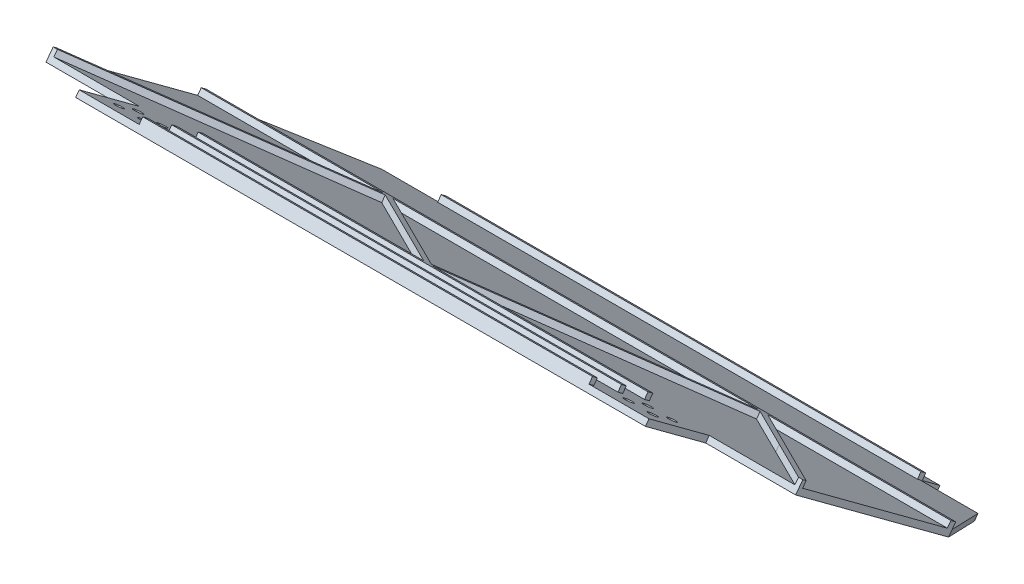
from build123d import *

# Parameters (mm, degrees)
SHELL_2_T            = -3
SKETCH_4_R           = 1.5
CUT_EXTRUDE_1_DEPTH  = 10
EXTRUDE_1_DEPTH      = 40.5
SKETCH_7_R           = 1.51
CUT_EXTRUDE_2_DEPTH  = 100
SKETCH_8_R           = 1.5
EXTRUDE_2_DEPTH      = 3
EXTRUDE_3_DEPTH      = 4
SKETCH_11_W          = 56.2
SKETCH_11_H          = 25
CUT_EXTRUDE_3_DEPTH  = 4
SKETCH_12_W          = 3
SKETCH_12_H          = 215
EXTRUDE_5_DEPTH      = 10
SKETCH_13_W          = 10
SKETCH_13_H          = 215
CUT_EXTRUDE_4_DEPTH  = 300
SKETCH_15_W          = 116.702064096
SKETCH_15_H          = 65.174269722
SKETCH_15_W_2        = 111.85
SKETCH_15_H_2        = 80
CUT_EXTRUDE_5_DEPTH  = 4
EXTRUDE_6_DEPTH      = 4
SKETCH_17_W          = 56.2
SKETCH_17_H          = 25
CUT_EXTRUDE_6_DEPTH  = 4
EXTRUDE_7_DEPTH      = 4
SKETCH_20_R          = 1.5
CUT_EXTRUDE_7_DEPTH  = 10
SKETCH_21_W          = 185
SKETCH_21_H          = 185
CUT_EXTRUDE_8_DEPTH  = 37.5
EXTRUDE_START        = 1
SKETCH_22_W          = 185
SKETCH_22_H          = 185
SKETCH_22_R          = 1.5
EXTRUDE_8_DEPTH      = 1
CUT_EXTRUDE_START    = -2
SKETCH_24_R          = 3
SKETCH_24_R_2        = 1.5
CUT_EXTRUDE_9_DEPTH  = 2
SKETCH_25_R          = 1.51
CUT_EXTRUDE_10_DEPTH = 10
SKETCH_26_R          = 1.5
EXTRUDE_9_DEPTH      = 4
EXTRUDE_START_2      = -4
SKETCH_28_R          = 3
EXTRUDE_10_DEPTH     = 4
SKETCH_29_R          = 3
CUT_EXTRUDE_11_DEPTH = 2
SKETCH_30_W          = 20
SKETCH_30_H          = 20
EXTRUDE_11_DEPTH     = 300
EXTRUDE_11_2_DEPTH   = 300
EXTRUDE_11_3_DEPTH   = 300
EXTRUDE_11_4_DEPTH   = 300
SKETCH_31_W          = 20
SKETCH_31_H          = 20
EXTRUDE_12_DEPTH     = 300
EXTRUDE_13_DEPTH     = 2
EXTRUDE_14_DEPTH     = 2
SKETCH_34_W          = 360
SKETCH_34_H          = 2
EXTRUDE_15_DEPTH     = 40
CUT_EXTRUDE_12_DEPTH = 400
SKETCH_36_W          = 360
SKETCH_36_H          = 35.328815684
CUT_EXTRUDE_13_DEPTH = 1
SKETCH_38_W          = 80
SKETCH_38_H          = 33.975155378
CUT_EXTRUDE_16_DEPTH = 3
SKETCH_40_R          = 1.5
CUT_EXTRUDE_17_DEPTH = 3
CUT_EXTRUDE_18_DEPTH = 3
SKETCH_42_W          = 20
SKETCH_42_H          = 20
SKETCH_42_W_2        = 200
SKETCH_42_H_2        = 194.4594667
CUT_EXTRUDE_19_DEPTH = 1000
SKETCH_43_W          = 200
SKETCH_43_H          = 10.011542291
CUT_EXTRUDE_20_DEPTH = 1000
SKETCH_44_W          = 5
SKETCH_44_H          = 25
CUT_EXTRUDE_21_DEPTH = 5
SKETCH_46_W          = 190
SKETCH_46_H          = 2
EXTRUDE_16_DEPTH     = 2
SKETCH_47_W          = 20
SKETCH_47_H          = 25
CUT_EXTRUDE_22_DEPTH = 2
SKETCH_48_W          = 250
SKETCH_48_H          = 2
EXTRUDE_17_DEPTH     = 2
EXTRUDE_18_DEPTH     = 2
CUT_EXTRUDE_24_DEPTH = 2
CUT_EXTRUDE_25_DEPTH = 2


with BuildPart() as part:
    # 草图3 → 放样1 section 0
    with BuildSketch(Plane.XY.offset(20)):
        with BuildLine():
            Line((-32.460246779, 32.274755465), (182.539753221, 32.274755465))
            Line((182.539753221, 32.274755465), (182.539753221, -182.725244535))
            Line((182.539753221, -182.725244535), (-32.460246779, -182.725244535))
            Line((-32.460246779, -182.725244535), (-32.460246779, 32.274755465))
        make_face()
    # 草图1 → 放样1 section 1
    with BuildSketch(Plane.XY):
        with BuildLine():
            Line((-17.5, -167.5), (167.5, -167.5))
            Line((167.5, -167.5), (167.5, 17.5))
            Line((167.5, 17.5), (-17.5, 17.5))
            Line((-17.5, 17.5), (-17.5, -167.5))
        make_face()
    loft()

    # 抽壳2
    shell_2_openings = [part.faces().sort_by_distance(p)[0] for p in [
        (75.039753221, -75.225244535, 20),
    ]]
    offset(amount=SHELL_2_T, openings=shell_2_openings, kind=Kind.INTERSECTION)

    # 草图4 → 切除-拉伸1 (cut)
    with BuildSketch(Plane.XY.offset(3)):
        with Locations((47.75, -75.225244535)):
            Circle(SKETCH_4_R)
        with Locations((84.75, -75.225244535)):
            Circle(SKETCH_4_R)
        with Locations((73.25, -75.225244535)):
            Circle(SKETCH_4_R)
        with Locations((59.25, -75.225244535)):
            Circle(SKETCH_4_R)
        with Locations((66.25, -68.225244535)):
            Circle(SKETCH_4_R)
        with Locations((66.25, -82.225244535)):
            Circle(SKETCH_4_R)
    extrude(amount=-CUT_EXTRUDE_1_DEPTH, mode=Mode.SUBTRACT)

    # 草图6 → 凸台-拉伸1 (add)
    with BuildSketch(Plane.XY.offset(3)):
        Polygon((38.15, -62.5), (34.15, -62.5), (31.15, -62.5), (31.15, -65.5), (34.15, -65.5), (34.15, -84.5), (31.15, -84.5), (31.15, -87.5), (34.15, -87.5), (38.15, -87.5), (38.15, -75), align=None)
        Polygon((94.35, -75), (94.35, -62.5), (98.35, -62.5), (101.35, -62.5), (101.35, -65.5), (98.35, -65.5), (98.35, -84.5), (101.35, -84.5), (101.35, -87.5), (98.35, -87.5), (94.35, -87.5), align=None)
    extrude(amount=-EXTRUDE_1_DEPTH)

    # 草图7 → 切除-拉伸2 (cut)
    with BuildSketch(Plane(origin=(98.35, 0, 0), x_dir=(0, 0, -1), z_dir=(1, 0, 0))):
        with Locations((16.5, -75)):
            Circle(SKETCH_7_R)
        with Locations((33.5, -75)):
            Circle(SKETCH_7_R)
    extrude(amount=-CUT_EXTRUDE_2_DEPTH, mode=Mode.SUBTRACT)

    # 草图8 → 凸台-拉伸2 (add)
    with BuildSketch(Plane.XY.offset(3)):
        with Locations((66.25, -68.225244535)):
            Circle(SKETCH_8_R)
        with Locations((59.25, -75.225244535)):
            Circle(SKETCH_8_R)
        with Locations((47.75, -75.225244535)):
            Circle(SKETCH_8_R)
        with Locations((73.25, -75.225244535)):
            Circle(SKETCH_8_R)
        with Locations((84.75, -75.225244535)):
            Circle(SKETCH_8_R)
        with Locations((66.25, -82.225244535)):
            Circle(SKETCH_8_R)
    extrude(amount=-EXTRUDE_2_DEPTH)

    # 草图9 → 凸台-拉伸3 (add)
    with BuildSketch(Plane(origin=(0, 0, 0), x_dir=(-1, 0, 0), z_dir=(0, 0, -1))):
        Polygon((-73.585786438, -76.414213562), (0, -2.828427125), (0, 0), (-2.828427125, 0), (-72.748638048, -69.920210924), (-150, -147.171572875), (-150, -150), (-147.171572875, -150), align=None)
    extrude(amount=EXTRUDE_3_DEPTH)

    # 草图11 → 切除-拉伸3 (cut)
    with BuildSketch(Plane(origin=(0, 0, -4), x_dir=(-1, 0, 0), z_dir=(0, 0, -1))):
        with Locations((-66.25, -75)):
            Rectangle(SKETCH_11_W, SKETCH_11_H)
    extrude(amount=-CUT_EXTRUDE_3_DEPTH, mode=Mode.SUBTRACT)


with BuildPart() as body_2:
    # 草图12 → 凸台-拉伸5 (new body)
    with BuildSketch(Plane.XY.offset(20)):
        with Locations((184.039753221, -75.225244535)):
            Rectangle(SKETCH_12_W, SKETCH_12_H)
    extrude(amount=-EXTRUDE_5_DEPTH)


with BuildPart() as cut_extrude_4_tool:
    # 草图13 → 切除-拉伸4 (new body)
    with BuildSketch(Plane(origin=(185.539753221, 0, 0), x_dir=(0, 0, -1), z_dir=(1, 0, 0))):
        with Locations((-15, -75.225244535)):
            Rectangle(SKETCH_13_W, SKETCH_13_H)
    extrude(amount=-CUT_EXTRUDE_4_DEPTH)


with BuildPart() as part_1:
    add(part.part)

    # 切除-拉伸4: cut by cut_extrude_4_tool
    add(cut_extrude_4_tool.part, mode=Mode.SUBTRACT)

    # 草图15 → 切除-拉伸5 (cut)
    with BuildSketch(Plane(origin=(0, 0, -4), x_dir=(-1, 0, 0), z_dir=(0, 0, -1))):
        with Locations((-96.501032048, -120.087134861)):
            Rectangle(SKETCH_15_W, SKETCH_15_H)
        with Locations((-38.425, -22.5)):
            Rectangle(SKETCH_15_W_2, SKETCH_15_H_2)
    extrude(amount=-CUT_EXTRUDE_5_DEPTH, mode=Mode.SUBTRACT)

    # 草图16 → 凸台-拉伸6 (add)
    with BuildSketch(Plane(origin=(0, 0, 0), x_dir=(-1, 0, 0), z_dir=(0, 0, -1))):
        Polygon((-77.828427125, -75), (-167.5, -164.671572875), (-167.5, -167.5), (-164.671572875, -167.5), (-75, -77.828427125), (14.671572875, -167.5), (17.5, -167.5), (17.5, -164.671572875), (-72.171572875, -75), (17.5, 14.671572875), (17.5, 17.5), (14.671572875, 17.5), (-75, -72.171572875), (-164.671572875, 17.5), (-167.5, 17.5), (-167.5, 14.671572875), align=None)
    extrude(amount=EXTRUDE_6_DEPTH)

    # 草图17 → 切除-拉伸6 (cut)
    with BuildSketch(Plane(origin=(0, 0, 0), x_dir=(-1, 0, 0), z_dir=(0, 0, -1))):
        with Locations((-66.25, -75)):
            Rectangle(SKETCH_17_W, SKETCH_17_H)
    extrude(amount=CUT_EXTRUDE_6_DEPTH, mode=Mode.SUBTRACT)

    # 草图18 → 凸台-拉伸7 (add)
    with BuildSketch(Plane(origin=(0, 0, 0), x_dir=(-1, 0, 0), z_dir=(0, 0, -1))):
        Polygon((-75, -119.25), (-33.578427125, -119.25), (-31.578427125, -121.25), (-29.578427125, -123.25), (-75, -123.25), (-120.421572875, -123.25), (-116.421572875, -119.25), align=None)
        Polygon((-119.25, -75), (-119.25, -116.421572875), (-121.25, -118.421572875), (-123.25, -120.421572875), (-123.25, -75), (-123.25, -29.578427125), (-119.25, -33.578427125), align=None)
        Polygon((-75, -30.75), (-116.421572875, -30.75), (-120.421572875, -26.75), (-75, -26.75), (-29.578427125, -26.75), (-33.578427125, -30.75), align=None)
        Polygon((-30.75, -33.578427125), (-26.75, -29.578427125), (-26.75, -75), (-26.75, -120.421572875), (-30.75, -116.421572875), (-30.75, -75), align=None)
    extrude(amount=EXTRUDE_7_DEPTH)

    # 草图20 → 切除-拉伸7 (cut)
    with BuildSketch(Plane(origin=(0, 0, 0), x_dir=(-1, 0, 0), z_dir=(0, 0, -1))):
        with Locations((-66.25, -82)):
            Circle(SKETCH_20_R)
        with Locations((-47.75, -75)):
            Circle(SKETCH_20_R)
        with Locations((-84.75, -75)):
            Circle(SKETCH_20_R)
        with Locations((-66.25, -68)):
            Circle(SKETCH_20_R)
    extrude(amount=-CUT_EXTRUDE_7_DEPTH, mode=Mode.SUBTRACT)

    # 草图21 → 切除-拉伸8 (cut)
    with BuildSketch(Plane(origin=(0, 0, -37.5), x_dir=(-1, 0, 0), z_dir=(0, 0, -1))):
        with Locations((-75, -75)):
            Rectangle(SKETCH_21_W, SKETCH_21_H)
    extrude(amount=-CUT_EXTRUDE_8_DEPTH, mode=Mode.SUBTRACT)

    # 草图22 → 凸台-拉伸8 (add)
    with BuildSketch(Plane(origin=(0, 0, 0), x_dir=(-1, 0, 0), z_dir=(0, 0, -1)).offset(EXTRUDE_START)):
        with Locations((-75, -75)):
            Rectangle(SKETCH_22_W, SKETCH_22_H)
        with Locations((-66.25, -68)):
            Circle(SKETCH_22_R, mode=Mode.SUBTRACT)
        with Locations((-66.25, -82)):
            Circle(SKETCH_22_R, mode=Mode.SUBTRACT)
        with Locations((-84.75, -75)):
            Circle(SKETCH_22_R, mode=Mode.SUBTRACT)
        with Locations((-47.75, -75)):
            Circle(SKETCH_22_R, mode=Mode.SUBTRACT)
    extrude(amount=-EXTRUDE_8_DEPTH)

    # 草图24 → 切除-拉伸9 (cut)
    # profile 1 of 4: a face of its own
    with BuildSketch(Plane.XY.offset(3).offset(CUT_EXTRUDE_START)):
        with Locations((66.25, -68)):
            Circle(SKETCH_24_R)
        with Locations((66.25, -68)):
            Circle(SKETCH_24_R_2, mode=Mode.SUBTRACT)
    # profile 2 of 4: a face of its own
    with BuildSketch(Plane.XY.offset(3).offset(CUT_EXTRUDE_START)):
        with Locations((66.25, -82)):
            Circle(SKETCH_24_R)
        with Locations((66.25, -82)):
            Circle(SKETCH_24_R_2, mode=Mode.SUBTRACT)
    # profile 3 of 4: a face of its own
    with BuildSketch(Plane.XY.offset(3).offset(CUT_EXTRUDE_START)):
        with Locations((47.75, -75)):
            Circle(SKETCH_24_R)
    # profile 4 of 4: a face of its own
    with BuildSketch(Plane.XY.offset(3).offset(CUT_EXTRUDE_START)):
        with Locations((84.75, -75)):
            Circle(SKETCH_24_R)
        with Locations((84.75, -75)):
            Circle(SKETCH_24_R_2, mode=Mode.SUBTRACT)
    extrude(amount=CUT_EXTRUDE_9_DEPTH, mode=Mode.SUBTRACT)

    # 草图25 → 切除-拉伸10 (cut)
    with BuildSketch(Plane(origin=(0, 0, -1), x_dir=(-1, 0, 0), z_dir=(0, 0, -1))):
        with Locations((-75, -68)):
            Circle(SKETCH_25_R)
        with Locations((-75, -82)):
            Circle(SKETCH_25_R)
        with Locations((-56.5, -75)):
            Circle(SKETCH_25_R)
        with Locations((-93.5, -75)):
            Circle(SKETCH_25_R)
    extrude(amount=-CUT_EXTRUDE_10_DEPTH, mode=Mode.SUBTRACT)

    # 草图26 → 凸台-拉伸9 (add)
    with BuildSketch(Plane(origin=(0, 0, -1), x_dir=(-1, 0, 0), z_dir=(0, 0, -1))):
        with Locations((-84.75, -75)):
            Circle(SKETCH_26_R)
        with Locations((-66.25, -68)):
            Circle(SKETCH_26_R)
        with Locations((-66.25, -82)):
            Circle(SKETCH_26_R)
        with Locations((-47.75, -75)):
            Circle(SKETCH_26_R)
    extrude(amount=-EXTRUDE_9_DEPTH)

    # 草图28 → 凸台-拉伸10 (add)
    with BuildSketch(Plane.XY.offset(3).offset(EXTRUDE_START_2)):
        with Locations((84.75, -75)):
            Circle(SKETCH_28_R)
        with Locations((66.25, -68)):
            Circle(SKETCH_28_R)
        with Locations((47.75, -75)):
            Circle(SKETCH_28_R)
        with Locations((66.25, -82)):
            Circle(SKETCH_28_R)
    extrude(amount=EXTRUDE_10_DEPTH)

    # 草图29 → 切除-拉伸11 (cut)
    with BuildSketch(Plane.XY.offset(3)):
        with Locations((75, -68)):
            Circle(SKETCH_29_R)
        with Locations((75, -82)):
            Circle(SKETCH_29_R)
        with Locations((93.5, -75)):
            Circle(SKETCH_29_R)
        with Locations((56.5, -75)):
            Circle(SKETCH_29_R)
    extrude(amount=-CUT_EXTRUDE_11_DEPTH, mode=Mode.SUBTRACT)

    # 草图32 → 凸台-拉伸13 (add)
    with BuildSketch(Plane(origin=(0, 11.321485901, -8.363609284), x_dir=(1, 0, 0), z_dir=(0, 0.804327079908719, -0.5941867959871823))):
        Polygon((-24.98012339, -22.831022035), (-19.370030847, -13.506457206), (169.379969153, -13.506457206), (175.01987661, -22.831022035), (255.01987661, -155.799450038), (-104.98012339, -155.799450038), align=None)
    extrude(amount=EXTRUDE_13_DEPTH)

    # 草图33 → 凸台-拉伸14 (add)
    with BuildSketch(Plane(origin=(0, 12.930140061, -9.551982876), x_dir=(1, 0, 0), z_dir=(0, 0.8043270799087189, -0.5941867959871823))):
        Polygon((-24.98012339, -22.831022035), (175.01987661, -22.831022035), (173.810188531, -20.831022035), (170.159993158, -20.831022035), (-23.776830229, -20.831022035), align=None)
    extrude(amount=EXTRUDE_14_DEPTH)



with BuildPart() as body_2_1:
    add(body_2.part)

    # 切除-拉伸4: cut by cut_extrude_4_tool
    add(cut_extrude_4_tool.part, mode=Mode.SUBTRACT)


with BuildPart() as body_2_2:
    # 草图30 → 凸台-拉伸11 (new body)
    with BuildSketch(Plane.XY.offset(10)):
        with Locations((-114.98012339, 114.887377733)):
            Rectangle(SKETCH_30_W, SKETCH_30_H)
    extrude(amount=EXTRUDE_11_DEPTH)



with BuildPart() as body_3:
    # 草图30 → Extrude 11 2 (new body)
    with BuildSketch(Plane.XY.offset(10)):
        with Locations((265.01987661, 114.887377733)):
            Rectangle(SKETCH_30_W, SKETCH_30_H)
    extrude(amount=EXTRUDE_11_2_DEPTH)


with BuildPart() as body_4:
    # 草图30 → Extrude 11 3 (new body)
    with BuildSketch(Plane.XY.offset(10)):
        with Locations((-114.98012339, -265.112622267)):
            Rectangle(SKETCH_30_W, SKETCH_30_H)
    extrude(amount=EXTRUDE_11_3_DEPTH)


with BuildPart() as body_5:
    # 草图30 → Extrude 11 4 (new body)
    with BuildSketch(Plane.XY.offset(10)):
        with Locations((265.01987661, -265.112622267)):
            Rectangle(SKETCH_30_W, SKETCH_30_H)
    extrude(amount=EXTRUDE_11_4_DEPTH)


with BuildPart() as body_2_2_1:
    add(body_2_2.part)

    add(body_3.part)  # 凸台-拉伸12 merges body 3

    add(body_4.part)  # 凸台-拉伸12 merges body 4

    add(body_5.part)  # 凸台-拉伸12 merges body 5
    # 草图31 → 凸台-拉伸12 (add)
    with BuildSketch(Plane(origin=(0, 0, 10), x_dir=(-1, 0, 0), z_dir=(0, 0, -1))):
        with Locations((-265.01987661, 114.887377733)):
            Rectangle(SKETCH_31_W, SKETCH_31_H)
        with Locations((114.98012339, 114.887377733)):
            Rectangle(SKETCH_31_W, SKETCH_31_H)
        with Locations((114.98012339, -265.112622267)):
            Rectangle(SKETCH_31_W, SKETCH_31_H)
        with Locations((-265.01987661, -265.112622267)):
            Rectangle(SKETCH_31_W, SKETCH_31_H)
    extrude(amount=EXTRUDE_12_DEPTH)


with BuildPart() as part_2:
    add(part_1.part)

    add(body_2_2_1.part)  # 凸台-拉伸15 merges body 2 2
    # 草图34 → 凸台-拉伸15 (add)
    with BuildSketch(Plane(origin=(0, 92.573976034, 125.3137167), x_dir=(1, 0, 0), z_dir=(0, 0.5941867959871824, 0.8043270799087189))):
        with Locations((75.01987661, 15.075723898)):
            Rectangle(SKETCH_34_W, SKETCH_34_H)
    extrude(amount=EXTRUDE_15_DEPTH)

    # 草图35 → 切除-拉伸12 (cut)
    with BuildSketch(Plane(origin=(255.01987661, 0, 0), x_dir=(0, 0, -1), z_dir=(1, 0, 0))):
        Polygon((-149.123190612, 127.662933775), (-145.366030572, 124.887377733), (-142.000085698, 124.887377733), (-147.93481702, 129.271587935), align=None)
    extrude(amount=-CUT_EXTRUDE_12_DEPTH, mode=Mode.SUBTRACT)

    # 草图36 → 切除-拉伸13 (cut)
    with BuildSketch(Plane(origin=(0, 11.321485901, -8.363609284), x_dir=(1, 0, 0), z_dir=(0, -0.8043270799087189, 0.5941867959871824))):
        with Locations((75.01987661, 173.46385788)):
            Rectangle(SKETCH_36_W, SKETCH_36_H)
    extrude(amount=-CUT_EXTRUDE_13_DEPTH, mode=Mode.SUBTRACT)

    # 草图38 → 切除-拉伸16 (cut)
    with BuildSketch(Plane(origin=(0, 12.930140061, -9.551982876), x_dir=(1, 0, 0), z_dir=(0, 0.8043270799087189, -0.5941867959871824))):
        with Locations((-64.98012339, -172.787027727)):
            Rectangle(SKETCH_38_W, SKETCH_38_H)
        with Locations((215.01987661, -172.787027727)):
            Rectangle(SKETCH_38_W, SKETCH_38_H)
    extrude(amount=-CUT_EXTRUDE_16_DEPTH, mode=Mode.SUBTRACT)

    # 草图40 → 切除-拉伸17 (cut)
    with BuildSketch(Plane(origin=(0, 11.321485901, -8.363609284), x_dir=(1, 0, 0), z_dir=(0, -0.8043270799087189, 0.5941867959871824))):
        Polygon((-24.98012339, 189.774605416), (-24.98012339, 155.799450038), (-104.98012339, 155.799450038), (-104.98012339, 127.787027727), (-24.98012339, 127.787027727), (-24.98012339, 152.787027727), (175.01987661, 152.787027727), (175.01987661, 127.787027727), (255.01987661, 127.787027727), (255.01987661, 155.799450038), (175.01987661, 155.799450038), (175.01987661, 189.774605416), align=None)
        with Locations((156.01987661, 143.787027727)):
            Circle(SKETCH_40_R)
        with Locations((164.01987661, 143.787027727)):
            Circle(SKETCH_40_R)
        with Locations((164.01987661, 135.787027727)):
            Circle(SKETCH_40_R)
        with Locations((156.01987661, 135.787027727)):
            Circle(SKETCH_40_R)
        with Locations((-13.98012339, 143.787027727)):
            Circle(SKETCH_40_R)
        with Locations((-5.98012339, 143.787027727)):
            Circle(SKETCH_40_R)
        with Locations((-13.98012339, 135.787027727)):
            Circle(SKETCH_40_R)
        with Locations((-5.98012339, 135.787027727)):
            Circle(SKETCH_40_R)
    extrude(amount=-CUT_EXTRUDE_17_DEPTH, mode=Mode.SUBTRACT)

    # 草图41 → 切除-拉伸18 (cut)
    with BuildSketch(Plane(origin=(0, 11.321485901, -8.363609284), x_dir=(-1, 0, 0), z_dir=(0, -0.8043270799087189, 0.5941867959871824))):
        Polygon((88.1265453, -127.787027727), (49.98012339, -64.383655786), (49.98012339, -127.787027727), align=None)
        Polygon((-200.01987661, -127.787027727), (-200.01987661, -64.383655786), (-238.16629852, -127.787027727), align=None)
    extrude(amount=-CUT_EXTRUDE_18_DEPTH, mode=Mode.SUBTRACT)

    # 草图42 → 切除-拉伸19 (cut)
    with BuildSketch(Plane(origin=(0, 0, -290), x_dir=(-1, 0, 0), z_dir=(0, 0, -1))):
        with Locations((-265.01987661, 114.887377733)):
            Rectangle(SKETCH_42_W, SKETCH_42_H)
        with Locations((-265.01987661, -265.112622267)):
            Rectangle(SKETCH_42_W, SKETCH_42_H)
        with Locations((114.98012339, -265.112622267)):
            Rectangle(SKETCH_42_W, SKETCH_42_H)
        with Locations((114.98012339, 114.887377733)):
            Rectangle(SKETCH_42_W, SKETCH_42_H)
        with Locations((-75.01987661, -77.882888917)):
            Rectangle(SKETCH_42_W_2, SKETCH_42_H_2)
    extrude(amount=-CUT_EXTRUDE_19_DEPTH, mode=Mode.SUBTRACT)

    # 草图43 → 切除-拉伸20 (cut)
    with BuildSketch(Plane(origin=(0, 11.321485901, -8.363609284), x_dir=(1, 0, 0), z_dir=(0, -0.8043270799087189, 0.5941867959871824))):
        with Locations((75.01987661, 17.82525089)):
            Rectangle(SKETCH_43_W, SKETCH_43_H)
    extrude(amount=CUT_EXTRUDE_20_DEPTH, mode=Mode.SUBTRACT)

    # 草图44 → 切除-拉伸21 (cut)
    with BuildSketch(Plane(origin=(0, 11.321485901, -8.363609284), x_dir=(1, 0, 0), z_dir=(0, -0.8043270799087189, 0.5941867959871824))):
        with Locations((-22.48012339, 140.287027727)):
            Rectangle(SKETCH_44_W, SKETCH_44_H)
        with Locations((172.51987661, 140.287027727)):
            Rectangle(SKETCH_44_W, SKETCH_44_H)
    extrude(amount=-CUT_EXTRUDE_21_DEPTH, mode=Mode.SUBTRACT)

    # 草图46 → 凸台-拉伸16 (add)
    with BuildSketch(Plane(origin=(0, 12.930140061, -9.551982876), x_dir=(1, 0, 0), z_dir=(0, 0.8043270799087189, -0.5941867959871824))):
        with Locations((75.01987661, -151.787027727)):
            Rectangle(SKETCH_46_W, SKETCH_46_H)
        with Locations((75.01987661, -139.787027727)):
            Rectangle(SKETCH_46_W, SKETCH_46_H)
        with Locations((75.01987661, -128.787027727)):
            Rectangle(SKETCH_46_W, SKETCH_46_H)
    extrude(amount=EXTRUDE_16_DEPTH)

    # 草图47 → 切除-拉伸22 (cut)
    with BuildSketch(Plane(origin=(0, 12.930140061, -9.551982876), x_dir=(1, 0, 0), z_dir=(0, 0.8043270799087189, -0.5941867959871824))):
        with Locations((-9.98012339, -140.287027727)):
            Rectangle(SKETCH_47_W, SKETCH_47_H)
        with Locations((160.01987661, -140.287027727)):
            Rectangle(SKETCH_47_W, SKETCH_47_H)
    extrude(amount=CUT_EXTRUDE_22_DEPTH, mode=Mode.SUBTRACT)

    # 草图48 → 凸台-拉伸17 (add)
    with BuildSketch(Plane(origin=(0, 12.930140061, -9.551982876), x_dir=(1, 0, 0), z_dir=(0, 0.8043270799087189, -0.5941867959871824))):
        with Locations((75.01987661, -65.383655786)):
            Rectangle(SKETCH_48_W, SKETCH_48_H)
    extrude(amount=EXTRUDE_17_DEPTH)

    # 草图49 → 凸台-拉伸18 (add)
    with BuildSketch(Plane(origin=(0, 12.930140061, -9.551982876), x_dir=(1, 0, 0), z_dir=(0, 0.8043270799087189, -0.5941867959871824))):
        Polygon((-48.553225432, -127.787027727), (12.51987661, -67.785517321), (73.592978653, -127.787027727), (76.446665315, -127.787027727), (137.519927552, -67.785464823), (168.069055648, -97.798678968), (198.592978653, -127.787027727), (200.01987661, -127.787027727), (200.01987661, -126.385166191), (138.946774568, -66.383655786), (136.093087905, -66.383655786), (75.019825669, -126.385218689), (44.470697573, -96.372004544), (13.946774568, -66.383655786), (11.092978653, -66.383655786), (-49.98012339, -126.385166191), (-49.98012339, -127.787027727), align=None)
    extrude(amount=EXTRUDE_18_DEPTH)

    # 草图52 → 切除-拉伸24 (cut)
    with BuildSketch(Plane(origin=(0, 14.53879422, -10.740356468), x_dir=(1, 0, 0), z_dir=(-2.761171813339654e-15, 0.8043270799087192, -0.5941867959871818))):
        Polygon((-24.98012339, -22.831022035), (-4.98012339, -22.831022035), (-4.98012339, -20.831022035), (-23.776830229, -20.831022035), align=None)
        Polygon((175.01987661, -22.831022035), (155.01987661, -22.831022035), (155.01987661, -20.831022035), (173.810188531, -20.831022035), align=None)
    extrude(amount=-CUT_EXTRUDE_24_DEPTH, mode=Mode.SUBTRACT)

    # 草图53 → 切除-拉伸25 (cut)
    with BuildSketch(Plane(origin=(0, 12.930140061, -9.551982876), x_dir=(1, 0, 0), z_dir=(0, 0.8043270799087189, -0.5941867959871823))):
        Polygon((-4.98012339, -21.831022035), (-24.378476809, -21.831022035), (-19.370030847, -13.506457206), (-4.98012339, -13.506457206), align=None)
        Polygon((155.01987661, -21.831022035), (174.415032571, -21.831022035), (169.379969153, -13.506457206), (155.01987661, -13.506457206), align=None)
    extrude(amount=-CUT_EXTRUDE_25_DEPTH, mode=Mode.SUBTRACT)


solid = part_2.part
